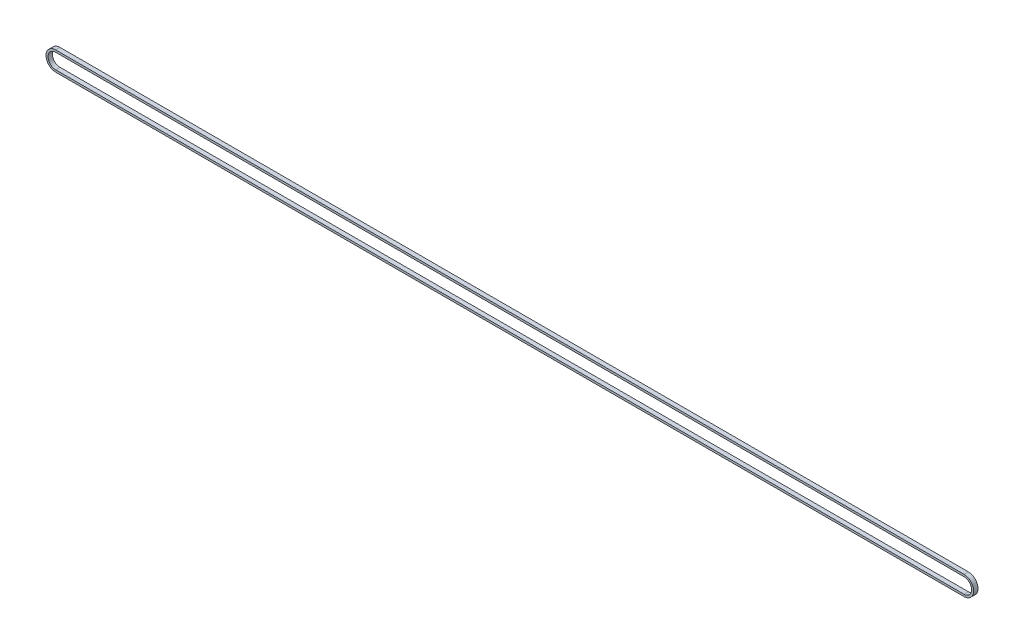
from build123d import *

# Parameters (mm, degrees)
EXTRUDE_THIN1_DEPTH = 2.5


with BuildPart() as part:
    # Sketch1 → Extrude-Thin1 (new, symmetric)
    with BuildSketch(Plane.XY):
        with BuildLine():
            Line((1047.8, -11.15), (0, -11.15))
            ThreePointArc((0, -11.15), (-11.15, 0), (0, 11.15))
            Line((0, 11.15), (1047.8, 11.15))
            ThreePointArc((1047.8, 11.15), (1058.95, 0), (1047.8, -11.15))
        make_face()
        with BuildLine():
            Line((1047.8, -8.75), (0, -8.75))
            ThreePointArc((0, -8.75), (-8.75, 0), (0, 8.75))
            Line((0, 8.75), (1047.8, 8.75))
            ThreePointArc((1047.8, 8.75), (1056.55, 0), (1047.8, -8.75))
        make_face(mode=Mode.SUBTRACT)
    extrude(amount=EXTRUDE_THIN1_DEPTH, both=True)


solid = part.part
